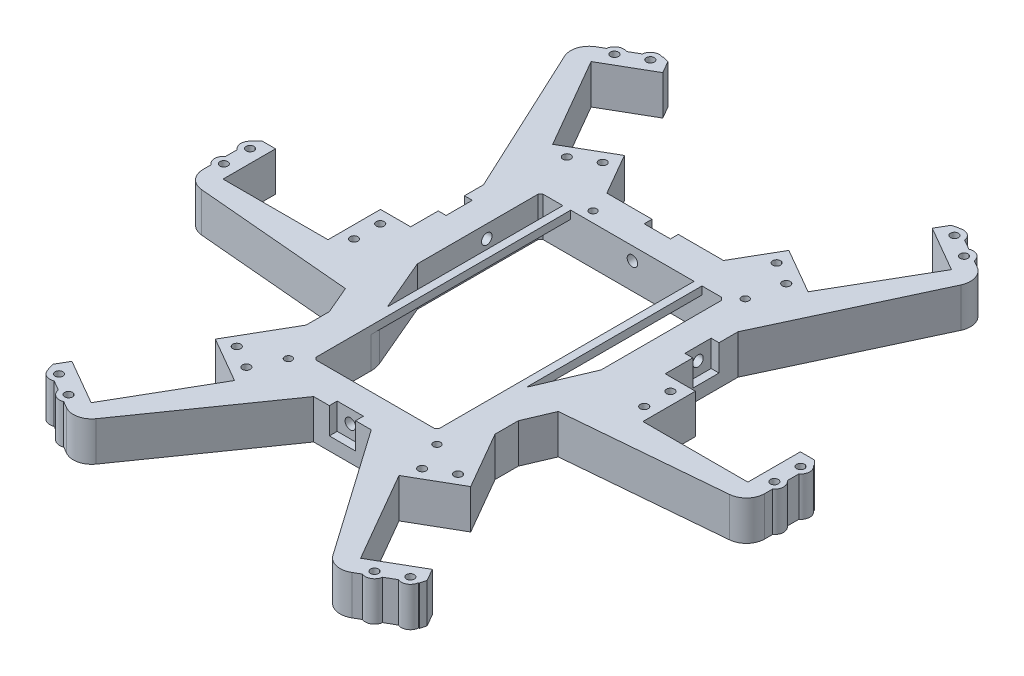
from build123d import *

# Parameters (mm, degrees)
BOSS_EXTRUDE1_DEPTH = 4
BOSS_EXTRUDE4_DEPTH = 15
CUT_EXTRUDE5_DEPTH  = 181.015958701
SKETCH15_R          = 1.4
CUT_EXTRUDE6_DEPTH  = 181.015958701
CHAMFER1_SIZE       = 1
SKETCH16_W          = 3
SKETCH16_H          = 100.597492804
BOSS_EXTRUDE7_DEPTH = 3
SKETCH17_W          = 10
SKETCH17_H          = 3
SKETCH17_W_2        = 3
SKETCH17_H_2        = 10
CUT_EXTRUDE7_DEPTH  = 10
FILLET1_R           = 7
SKETCH19_R          = 2
CUT_EXTRUDE10_DEPTH = 206.425514456
SKETCH20_R          = 2
CUT_EXTRUDE11_DEPTH = 211.923311402
CHAMFER5_SIZE       = 1.7
SKETCH26_R          = 3
CUT_EXTRUDE14_DEPTH = 6
CHAMFER7_SIZE       = 1.7
SKETCH28_R          = 1.5
CUT_EXTRUDE15_DEPTH = 179.206041685
SKETCH29_R          = 3.5
SKETCH29_R_2        = 1.5
BOSS_EXTRUDE8_DEPTH = 15


with BuildPart() as part:
    # Sketch1 → Boss-Extrude1 (new body)
    with BuildSketch(Plane(origin=(0, 0, 0), x_dir=(1, 0, 0), z_dir=(0, 1, 0))):
        with BuildLine():
            Line((-42.260071937, -28.563309365), (-31.239928063, -54.436690635))
            ThreePointArc((-31.239928063, -54.436690635), (-31.060593954, -55.012366758), (-31, -55.61227683))
            Line((-31, -55.61227683), (-31, -84))
            ThreePointArc((-31, -84), (-30.707106781, -84.707106781), (-30, -85))
            Line((-30, -85), (30, -85))
            ThreePointArc((30, -85), (30.707106781, -84.707106781), (31, -84))
            Line((31, -84), (31, -55.61227683))
            ThreePointArc((31, -55.61227683), (31.060593954, -55.012366758), (31.239928063, -54.436690635))
            Line((31.239928063, -54.436690635), (42.260071937, -28.563309365))
            ThreePointArc((42.260071937, -28.563309365), (42.439406046, -27.987633242), (42.5, -27.38772317))
            Line((42.5, -27.38772317), (42.5, 25))
            ThreePointArc((42.5, 25), (41.621320344, 27.121320344), (39.5, 28))
            Line((39.5, 28), (-39.5, 28))
            ThreePointArc((-39.5, 28), (-41.621320344, 27.121320344), (-42.5, 25))
            Line((-42.5, 25), (-42.5, -27.38772317))
            ThreePointArc((-42.5, -27.38772317), (-42.439406046, -27.987633242), (-42.260071937, -28.563309365))
        make_face()
    extrude(amount=BOSS_EXTRUDE1_DEPTH)

    # Sketch14 → Cut-Extrude5 (cut, through all)
    with BuildSketch(Plane(origin=(0, 0, 0), x_dir=(1, 0, 0), z_dir=(0, 1, 0))):
        with BuildLine():
            Line((39.5, 28), (-39.5, 28))
            ThreePointArc((-39.5, 28), (-41.621320344, 27.121320344), (-42.5, 25))
            Line((-42.5, 25), (-42.5, -27.38772317))
            ThreePointArc((-42.5, -27.38772317), (-42.439406046, -27.987633242), (-42.260071937, -28.563309365))
            Line((-42.260071937, -28.563309365), (-31.239928063, -54.436690635))
            ThreePointArc((-31.239928063, -54.436690635), (-31.060593954, -55.012366758), (-31, -55.61227683))
            Line((-31, -55.61227683), (-31, -84))
            ThreePointArc((-31, -84), (-30.707106781, -84.707106781), (-30, -85))
            Line((-30, -85), (30, -85))
            ThreePointArc((30, -85), (30.707106781, -84.707106781), (31, -84))
            Line((31, -84), (31, -55.61227683))
            ThreePointArc((31, -55.61227683), (31.060593954, -55.012366758), (31.239928063, -54.436690635))
            Line((31.239928063, -54.436690635), (42.260071937, -28.563309365))
            ThreePointArc((42.260071937, -28.563309365), (42.439406046, -27.987633242), (42.5, -27.38772317))
            Line((42.5, -27.38772317), (42.5, 25))
            ThreePointArc((42.5, 25), (41.621320344, 27.121320344), (39.5, 28))
        make_face()
    extrude(amount=CUT_EXTRUDE5_DEPTH, mode=Mode.SUBTRACT)


with BuildPart() as body_2:
    # Sketch11 → Boss-Extrude4 (new body)
    with BuildSketch(Plane(origin=(0, 0, 0), x_dir=(1, 0, 0), z_dir=(0, 1, 0))):
        with BuildLine():
            Line((48.660254038, 38.782032303), (31.339745962, 48.782032303))
            Line((31.339745962, 48.782032303), (22.227985364, 33))
            Line((22.227985364, 33), (0, 33))
            Line((0, 33), (0, 20.5))
            Line((0, 20.5), (35, 20.5))
            Line((35, 20.5), (35, -26.469307925))
            Line((35, -26.469307925), (24.339748221, -51.497725146))
            ThreePointArc((24.339748221, -51.497725146), (23.712078838, -53.512591578), (23.5, -55.61227683))
            Line((23.5, -55.61227683), (23.5, -77.5))
            Line((23.5, -77.5), (0, -77.5))
            Line((0, -77.5), (0, -90))
            Line((0, -90), (10.976705742, -90))
            Line((10.976705742, -90), (48.777568136, -143.985226281))
            Line((48.777568136, -143.985226281), (72.160254038, -130.485226281))
            Line((72.160254038, -130.485226281), (68.660254038, -124.423048454))
            Line((68.660254038, -124.423048454), (51.339745962, -134.423048454))
            Line((51.339745962, -134.423048454), (31.339745962, -99.782032303))
            Line((31.339745962, -99.782032303), (48.660254038, -89.782032303))
            Line((48.660254038, -89.782032303), (36, -67.853829072))
            Line((36, -67.853829072), (36, -59))
            Line((36, -59), (40.551667721, -48.313475785))
            Line((40.551667721, -48.313475785), (107, -42.5))
            Line((107, -42.5), (107, -15.5))
            Line((107, -15.5), (100, -15.5))
            Line((100, -15.5), (100, -35.5))
            Line((100, -35.5), (60, -35.5))
            Line((60, -35.5), (60, -15.5))
            Line((60, -15.5), (48.5, -15.5))
            Line((48.5, -15.5), (48.5, 12.245265453))
            Line((48.5, 12.245265453), (78.222431864, 75.985226281))
            Line((78.222431864, 75.985226281), (54.839745962, 89.485226281))
            Line((54.839745962, 89.485226281), (51.339745962, 83.423048454))
            Line((51.339745962, 83.423048454), (68.660254038, 73.423048454))
            Line((68.660254038, 73.423048454), (48.660254038, 38.782032303))
        make_face()
    boss_extrude4 = extrude(amount=-BOSS_EXTRUDE4_DEPTH)

    # Mirror1: Boss-Extrude4 across plane
    add(boss_extrude4.mirror(Plane(origin=(0, 0, 0), x_dir=(0, 0, 1), z_dir=(1, 0, 0))))

    # Sketch15 → Cut-Extrude6 (cut, through all)
    with BuildSketch(Plane(origin=(0, 0, 0), x_dir=(1, 0, 0), z_dir=(0, 1, 0))):
        with Locations(Location((-28.3, -82.3, 0), (0, 0, 270))):
            Circle(SKETCH15_R)
        with Locations(Location((28.3, -82.3, 0), (0, 0, 270))):
            Circle(SKETCH15_R)
        with Locations(Location((-19, 24.5, 0), (0, 0, 270))):
            Circle(SKETCH15_R)
        with Locations(Location((39, 24.5, 0), (0, 0, 270))):
            Circle(SKETCH15_R)
    extrude(amount=-CUT_EXTRUDE6_DEPTH, mode=Mode.SUBTRACT)

    # Chamfer1
    chamfer1_edges = [body_2.edges().sort_by_distance(p)[0] for p in [
        (-35, -7.5, -20.5),
        (-23.5, -7.5, 77.5),
        (23.5, -7.5, 77.5),
        (35, -7.5, -20.5),
    ]]
    chamfer(chamfer1_edges, length=CHAMFER1_SIZE)

    # Sketch16 → Boss-Extrude7 (add)
    with BuildSketch(Plane(origin=(0, 0, 0), x_dir=(1, 0, 0), z_dir=(0, 1, 0))):
        with Locations((25, -27.201253598)):
            Rectangle(SKETCH16_W, SKETCH16_H)
    boss_extrude7 = extrude(amount=-BOSS_EXTRUDE7_DEPTH)

    # Mirror2: Boss-Extrude7 across plane
    add(boss_extrude7.mirror(Plane(origin=(0, 0, 0), x_dir=(0, 0, 1), z_dir=(1, 0, 0))))

    # Sketch17 → Cut-Extrude7 (cut)
    with BuildSketch(Plane(origin=(0, 0, 0), x_dir=(1, 0, 0), z_dir=(0, 1, 0))):
        with Locations((0, 31.5)):
            Rectangle(SKETCH17_W, SKETCH17_H)
        with Locations((-47, 0)):
            Rectangle(SKETCH17_W_2, SKETCH17_H_2)
        with Locations((47, 0)):
            Rectangle(SKETCH17_W_2, SKETCH17_H_2)
        with Locations((0, -88.5)):
            Rectangle(SKETCH17_W, SKETCH17_H)
    extrude(amount=-CUT_EXTRUDE7_DEPTH, mode=Mode.SUBTRACT)

    # Fillet1
    fillet1_edges = [body_2.edges().sort_by_distance(p)[0] for p in [
        (-78.222431864, -7.5, -75.985226281),
        (-48.777568136, -7.5, 143.985226281),
        (48.777568136, -7.5, 143.985226281),
        (78.222431864, -7.5, -75.985226281),
        (107, -7.5, 42.5),
        (-107, -7.5, 42.5),
    ]]
    fillet(fillet1_edges, radius=FILLET1_R)

    # Sketch19 → Cut-Extrude10 (cut, through all)
    with BuildSketch(Plane(origin=(0, 0, -33), x_dir=(-1, 0, 0), z_dir=(0, 0, -1))):
        with Locations((0, -5)):
            Circle(SKETCH19_R)
    extrude(amount=-CUT_EXTRUDE10_DEPTH, mode=Mode.SUBTRACT)

    # Sketch20 → Cut-Extrude11 (cut, through all)
    with BuildSketch(Plane.ZY.offset(48.5)):
        with Locations((0, -5)):
            Circle(SKETCH20_R)
    extrude(amount=-CUT_EXTRUDE11_DEPTH, mode=Mode.SUBTRACT)

    # Chamfer5
    chamfer5_edges = [body_2.edges().sort_by_distance(p)[0] for p in [
        (-54.839745962, -7.5, -89.485226281),
        (-72.160254038, -7.5, 130.485226281),
        (72.160254038, -7.5, 130.485226281),
        (54.839745962, -7.5, -89.485226281),
        (107, -7.5, 15.5),
        (-107, -7.5, 15.5),
    ]]
    chamfer(chamfer5_edges, length=CHAMFER5_SIZE)

    # Sketch26 → Cut-Extrude14 (cut)
    with BuildSketch(Plane.XZ.offset(15)):
        with Locations(Location((-19, -24.5, 0), (0, 0, 270))):
            Circle(SKETCH26_R)
        with Locations(Location((39, -24.5, 0), (0, 0, 270))):
            Circle(SKETCH26_R)
        with Locations(Location((28.3, 82.3, 0), (0, 0, 270))):
            Circle(SKETCH26_R)
        with Locations(Location((-28.3, 82.3, 0), (0, 0, 270))):
            Circle(SKETCH26_R)
    extrude(amount=-CUT_EXTRUDE14_DEPTH, mode=Mode.SUBTRACT)

    # Chamfer7
    # the kernel refuses this chamfer: 1.7 mm, written as the material it takes off along each edge
    with BuildSketch(Plane(origin=(-28.3, -9, 82.3), x_dir=(0, 0, 1), z_dir=(-1, 0, 0))) as chamfer7_piece_1_section:
        Polygon((1.4, CHAMFER7_SIZE), (1.4 + CHAMFER7_SIZE, 0), (1.4, 0), align=None)
    chamfer7_piece_1 = revolve(axis=Axis((-28.3, -9, 82.3), (0, 1, 0)), mode=Mode.PRIVATE)
    chamfer7_piece_1 = chamfer7_piece_1 & Plane(origin=(-28.3, -8.094925142, 82.3), x_dir=(0, 0, -1), z_dir=(0, -1, 0)) * Cylinder(3, 13, mode=Mode.PRIVATE)
    add(chamfer7_piece_1, mode=Mode.SUBTRACT)
    with BuildSketch(Plane(origin=(28.3, -9, 82.3), x_dir=(0, 0, 1), z_dir=(-1, 0, 0))) as chamfer7_piece_2_section:
        Polygon((1.4, CHAMFER7_SIZE), (1.4 + CHAMFER7_SIZE, 0), (1.4, 0), align=None)
    chamfer7_piece_2 = revolve(axis=Axis((28.3, -9, 82.3), (0, 1, 0)), mode=Mode.PRIVATE)
    chamfer7_piece_2 = chamfer7_piece_2 & Plane(origin=(28.3, -8.094925142, 82.3), x_dir=(0, 0, -1), z_dir=(0, -1, 0)) * Cylinder(3, 13, mode=Mode.PRIVATE)
    add(chamfer7_piece_2, mode=Mode.SUBTRACT)
    with BuildSketch(Plane(origin=(39, -9, -24.5), x_dir=(0, 0, 1), z_dir=(-1, 0, 0))) as chamfer7_piece_3_section:
        Polygon((1.4, CHAMFER7_SIZE), (1.4 + CHAMFER7_SIZE, 0), (1.4, 0), align=None)
    chamfer7_piece_3 = revolve(axis=Axis((39, -9, -24.5), (0, 1, 0)), mode=Mode.PRIVATE)
    chamfer7_piece_3 = chamfer7_piece_3 & Plane(origin=(39, -8.094925142, -24.5), x_dir=(0, 0, -1), z_dir=(0, -1, 0)) * Cylinder(3, 13, mode=Mode.PRIVATE)
    add(chamfer7_piece_3, mode=Mode.SUBTRACT)
    with BuildSketch(Plane(origin=(-19, -9, -24.5), x_dir=(0, 0, 1), z_dir=(-1, 0, 0))) as chamfer7_piece_4_section:
        Polygon((1.4, CHAMFER7_SIZE), (1.4 + CHAMFER7_SIZE, 0), (1.4, 0), align=None)
    chamfer7_piece_4 = revolve(axis=Axis((-19, -9, -24.5), (0, 1, 0)), mode=Mode.PRIVATE)
    chamfer7_piece_4 = chamfer7_piece_4 & Plane(origin=(-19, -8.094925142, -24.5), x_dir=(0, 0, -1), z_dir=(0, -1, 0)) * Cylinder(3, 13, mode=Mode.PRIVATE)
    add(chamfer7_piece_4, mode=Mode.SUBTRACT)

    # Sketch28 → Cut-Extrude15 (cut, through all)
    with BuildSketch(Plane.XZ.offset(15)):
        with Locations(Location((-41.806921938, -37.311712905, 0), (0, 0, 270))):
            Circle(SKETCH28_R)
        with Locations(Location((-33.1466679, -42.311712905, 0), (0, 0, 270))):
            Circle(SKETCH28_R)
        with Locations(Location((-66.606921938, -80.266572933, 0), (0, 0, 270))):
            Circle(SKETCH28_R)
        with Locations(Location((-57.9466679, -85.266572933, 0), (0, 0, 270))):
            Circle(SKETCH28_R)
        with Locations(Location((33.1466679, -42.311712905, 0), (0, 0, 270))):
            Circle(SKETCH28_R)
        with Locations(Location((41.806921938, -37.311712905, 0), (0, 0, 270))):
            Circle(SKETCH28_R)
        with Locations(Location((57.9466679, -85.266572933, 0), (0, 0, 270))):
            Circle(SKETCH28_R)
        with Locations(Location((66.606921938, -80.266572933, 0), (0, 0, 270))):
            Circle(SKETCH28_R)
        with Locations(Location((55.3, 20.3, 0), (0, 0, 270))):
            Circle(SKETCH28_R)
        with Locations(Location((55.3, 30.3, 0), (0, 0, 270))):
            Circle(SKETCH28_R)
        with Locations(Location((104.9, 20.3, 0), (0, 0, 270))):
            Circle(SKETCH28_R)
        with Locations(Location((104.9, 30.3, 0), (0, 0, 270))):
            Circle(SKETCH28_R)
        with Locations(Location((33.493078062, 93.111712905, 0), (0, 0, 270))):
            Circle(SKETCH28_R)
        with Locations(Location((42.1533321, 88.111712905, 0), (0, 0, 270))):
            Circle(SKETCH28_R)
        with Locations(Location((58.293078062, 136.066572933, 0), (0, 0, 270))):
            Circle(SKETCH28_R)
        with Locations(Location((66.9533321, 131.066572933, 0), (0, 0, 270))):
            Circle(SKETCH28_R)
        with Locations(Location((-66.953332092, 131.066572936, 0), (0, 0, 270))):
            Circle(SKETCH28_R)
        with Locations(Location((-58.293078054, 136.066572936, 0), (0, 0, 270))):
            Circle(SKETCH28_R)
        with Locations(Location((-42.153332092, 88.111712909, 0), (0, 0, 270))):
            Circle(SKETCH28_R)
        with Locations(Location((-33.493078054, 93.111712909, 0), (0, 0, 270))):
            Circle(SKETCH28_R)
        with Locations(Location((-104.9, 20.3, 0), (0, 0, 270))):
            Circle(SKETCH28_R)
        with Locations(Location((-104.9, 30.3, 0), (0, 0, 270))):
            Circle(SKETCH28_R)
        with Locations(Location((-55.3, 20.3, 0), (0, 0, 270))):
            Circle(SKETCH28_R)
        with Locations(Location((-55.3, 30.3, 0), (0, 0, 270))):
            Circle(SKETCH28_R)
    extrude(amount=-CUT_EXTRUDE15_DEPTH, mode=Mode.SUBTRACT)

    # Sketch29 → Boss-Extrude8 (add)
    # profile 1 of 12: a face of its own
    with BuildSketch(Plane.XZ.offset(15)):
        with Locations((-66.606921938, -80.266572933)):
            Circle(SKETCH29_R)
        with Locations(Location((-66.606921938, -80.266572933, 0), (0, 0, 270))):
            Circle(SKETCH29_R_2, mode=Mode.SUBTRACT)
    # profile 2 of 12: a face of its own
    with BuildSketch(Plane.XZ.offset(15)):
        with Locations((-57.9466679, -85.266572933)):
            Circle(SKETCH29_R)
        with Locations(Location((-57.9466679, -85.266572933, 0), (0, 0, 270))):
            Circle(SKETCH29_R_2, mode=Mode.SUBTRACT)
    # profile 3 of 12: a face of its own
    with BuildSketch(Plane.XZ.offset(15)):
        with Locations((57.9466679, -85.266572933)):
            Circle(SKETCH29_R)
        with Locations(Location((57.9466679, -85.266572933, 0), (0, 0, 270))):
            Circle(SKETCH29_R_2, mode=Mode.SUBTRACT)
    # profile 4 of 12: a face of its own
    with BuildSketch(Plane.XZ.offset(15)):
        with Locations((66.606921938, -80.266572933)):
            Circle(SKETCH29_R)
        with Locations(Location((66.606921938, -80.266572933, 0), (0, 0, 270))):
            Circle(SKETCH29_R_2, mode=Mode.SUBTRACT)
    # profile 5 of 12: a face of its own
    with BuildSketch(Plane.XZ.offset(15)):
        with Locations((104.9, 30.3)):
            Circle(SKETCH29_R)
        with Locations(Location((104.9, 30.3, 0), (0, 0, 270))):
            Circle(SKETCH29_R_2, mode=Mode.SUBTRACT)
    # profile 6 of 12: a face of its own
    with BuildSketch(Plane.XZ.offset(15)):
        with Locations((104.9, 20.3)):
            Circle(SKETCH29_R)
        with Locations(Location((104.9, 20.3, 0), (0, 0, 270))):
            Circle(SKETCH29_R_2, mode=Mode.SUBTRACT)
    # profile 7 of 12: a face of its own
    with BuildSketch(Plane.XZ.offset(15)):
        with Locations((66.9533321, 131.066572933)):
            Circle(SKETCH29_R)
        with Locations(Location((66.9533321, 131.066572933, 0), (0, 0, 270))):
            Circle(SKETCH29_R_2, mode=Mode.SUBTRACT)
    # profile 8 of 12: a face of its own
    with BuildSketch(Plane.XZ.offset(15)):
        with Locations((58.293078062, 136.066572933)):
            Circle(SKETCH29_R)
        with Locations(Location((58.293078062, 136.066572933, 0), (0, 0, 270))):
            Circle(SKETCH29_R_2, mode=Mode.SUBTRACT)
    # profile 9 of 12: a face of its own
    with BuildSketch(Plane.XZ.offset(15)):
        with Locations((-66.953332092, 131.066572936)):
            Circle(SKETCH29_R)
        with Locations(Location((-66.953332092, 131.066572936, 0), (0, 0, 270))):
            Circle(SKETCH29_R_2, mode=Mode.SUBTRACT)
    # profile 10 of 12: a face of its own
    with BuildSketch(Plane.XZ.offset(15)):
        with Locations((-58.293078054, 136.066572936)):
            Circle(SKETCH29_R)
        with Locations(Location((-58.293078054, 136.066572936, 0), (0, 0, 270))):
            Circle(SKETCH29_R_2, mode=Mode.SUBTRACT)
    # profile 11 of 12: a face of its own
    with BuildSketch(Plane.XZ.offset(15)):
        with Locations((-104.9, 20.3)):
            Circle(SKETCH29_R)
        with Locations(Location((-104.9, 20.3, 0), (0, 0, 270))):
            Circle(SKETCH29_R_2, mode=Mode.SUBTRACT)
    # profile 12 of 12: a face of its own
    with BuildSketch(Plane.XZ.offset(15)):
        with Locations((-104.9, 30.3)):
            Circle(SKETCH29_R)
        with Locations(Location((-104.9, 30.3, 0), (0, 0, 270))):
            Circle(SKETCH29_R_2, mode=Mode.SUBTRACT)
    extrude(amount=-BOSS_EXTRUDE8_DEPTH)


solid = body_2.part
